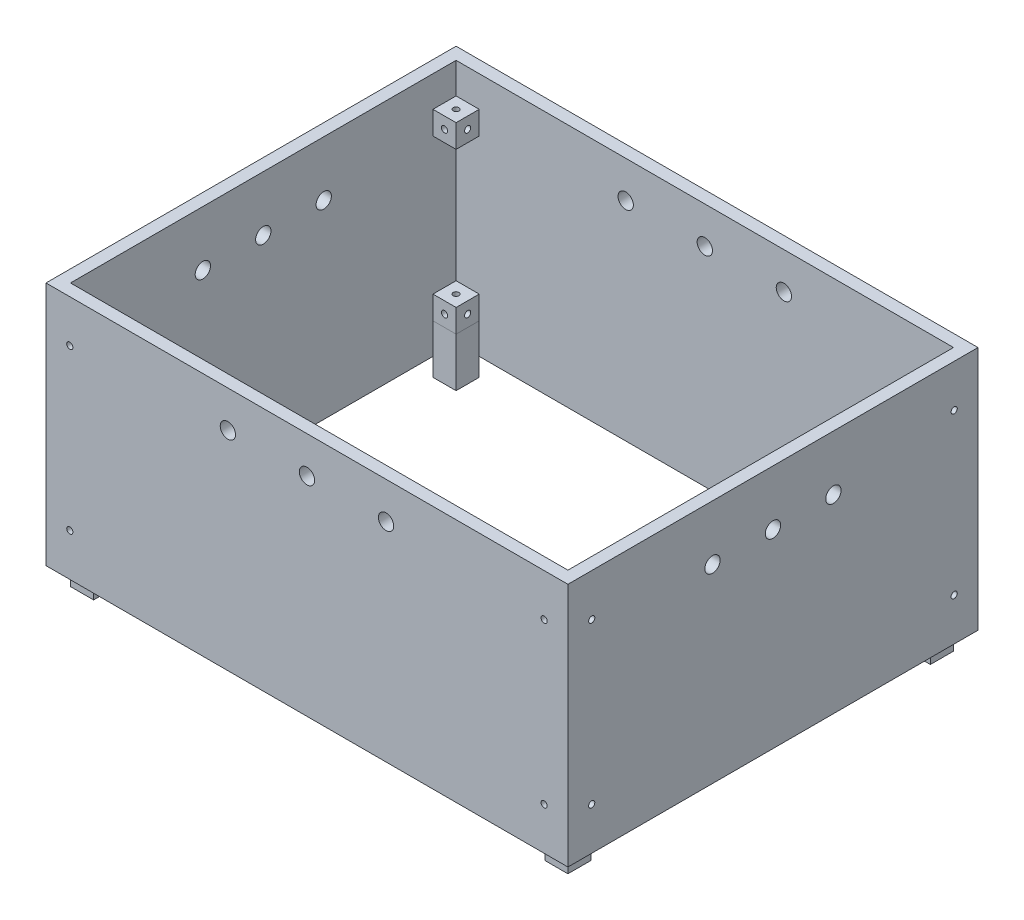
from build123d import *

# Parameters (mm, degrees)
SKETCH1_W            = 270.7
SKETCH1_H            = 212.7
SKETCH1_W_2          = 258
SKETCH1_H_2          = 200
WALLS_DEPTH          = 127
SKETCH2_R            = 3.96875
RODHOLESHEIGHT_DEPTH = 367.945200268
SKETCH4_R            = 3.96875
RODHOLESWIDTH_DEPTH  = 367.945200268
SKETCH3_W            = 12
SKETCH3_H            = 12
MODDINGCUBE_DEPTH    = 12
SKETCH11_R           = 1.6
CUT_EXTRUDE1_DEPTH   = 357.622226593
SKETCH17_R           = 1.5
SKETCH17_R_2         = 1.6
CUT_EXTRUDE4_DEPTH   = 359.218899557
SKETCH15_R           = 1.6
CUT_EXTRUDE2_DEPTH   = 354.625243019
SKETCH18_W           = 12
SKETCH18_H           = 12
PEGS_DEPTH           = 25.4
PEGS_2_DEPTH         = 25.4
PEGS_3_DEPTH         = 25.4
PEGS_4_DEPTH         = 25.4


with BuildPart() as part:
    # Sketch1 → Walls (new body)
    with BuildSketch(Plane(origin=(0, 0, 0), x_dir=(1, 0, 0), z_dir=(0, 1, 0))):
        with Locations((135.35, 106.35)):
            Rectangle(SKETCH1_W, SKETCH1_H)
        with Locations((135.35, 106.35)):
            Rectangle(SKETCH1_W_2, SKETCH1_H_2, mode=Mode.SUBTRACT)
    extrude(amount=WALLS_DEPTH)

    # Sketch2 → RodHolesHeight (cut, through all)
    with BuildSketch(Plane.XY):
        with Locations((135.35, 107.95)):
            Circle(SKETCH2_R)
        with Locations((94.33, 107.95)):
            Circle(SKETCH2_R)
        with Locations((176.366666667, 107.95)):
            Circle(SKETCH2_R)
    extrude(amount=-RODHOLESHEIGHT_DEPTH, mode=Mode.SUBTRACT)

    # Sketch4 → RodHolesWidth (cut, through all)
    with BuildSketch(Plane.ZY):
        with Locations((-106.35, 98.425)):
            Circle(SKETCH4_R)
        with Locations((-137.7, 98.425)):
            Circle(SKETCH4_R)
        with Locations((-75, 98.425)):
            Circle(SKETCH4_R)
    extrude(amount=-RODHOLESWIDTH_DEPTH, mode=Mode.SUBTRACT)

    # Sketch3 → ModdingCube (add)
    with BuildSketch(Plane(origin=(0, 0, -6.35), x_dir=(-1, 0, 0), z_dir=(0, 0, -1))):
        with Locations((-258.35, 105)):
            Rectangle(SKETCH3_W, SKETCH3_H)
        with Locations((-258.35, 22)):
            Rectangle(SKETCH3_W, SKETCH3_H)
        with Locations((-12.35, 105)):
            Rectangle(SKETCH3_W, SKETCH3_H)
        with Locations((-12.35, 22)):
            Rectangle(SKETCH3_W, SKETCH3_H)
    moddingcube = extrude(amount=MODDINGCUBE_DEPTH)

    # Sketch11 → Cut-Extrude1 (cut, symmetric)
    with BuildSketch(Plane(origin=(0, 0, -18.35), x_dir=(-1, 0, 0), z_dir=(0, 0, -1))):
        with Locations((-258.35, 105)):
            Circle(SKETCH11_R)
        with Locations((-258.35, 22)):
            Circle(SKETCH11_R)
        with Locations((-12.35, 105)):
            Circle(SKETCH11_R)
        with Locations((-12.35, 22)):
            Circle(SKETCH11_R)
    cut_extrude1 = extrude(amount=CUT_EXTRUDE1_DEPTH, both=True, mode=Mode.SUBTRACT)

    # Sketch17 → Cut-Extrude4 (cut, symmetric)
    with BuildSketch(Plane(origin=(0, 28, 0), x_dir=(1, 0, 0), z_dir=(0, 1, 0))):
        with Locations((12.35, 12.35)):
            Circle(SKETCH17_R)
        with Locations((258.35, 12.35)):
            Circle(SKETCH17_R_2)
    cut_extrude4 = extrude(amount=CUT_EXTRUDE4_DEPTH, both=True, mode=Mode.SUBTRACT)

    # Sketch15 → Cut-Extrude2 (cut, symmetric)
    with BuildSketch(Plane.ZY.offset(-252.35)):
        with Locations((-12.35, 105)):
            Circle(SKETCH15_R)
        with Locations((-12.35, 22)):
            Circle(SKETCH15_R)
    cut_extrude2 = extrude(amount=CUT_EXTRUDE2_DEPTH, both=True, mode=Mode.SUBTRACT)

    # Mirror6: ModdingCube, Cut-Extrude1, Cut-Extrude4, Cut-Extrude2 across plane
    add(moddingcube.mirror(Plane(origin=(0, 0, -106.35), x_dir=(1, 0, 0), z_dir=(0, 0, -1))))
    add(cut_extrude1.mirror(Plane(origin=(0, 0, -106.35), x_dir=(1, 0, 0), z_dir=(0, 0, -1))), mode=Mode.SUBTRACT)
    add(cut_extrude4.mirror(Plane(origin=(0, 0, -106.35), x_dir=(1, 0, 0), z_dir=(0, 0, -1))), mode=Mode.SUBTRACT)
    add(cut_extrude2.mirror(Plane(origin=(0, 0, -106.35), x_dir=(1, 0, 0), z_dir=(0, 0, -1))), mode=Mode.SUBTRACT)


with BuildPart() as body_2:
    # Sketch18 → Pegs (new body)
    with BuildSketch(Plane.XZ.offset(-16)):
        with Locations((12.35, -12.35)):
            Rectangle(SKETCH18_W, SKETCH18_H)
    extrude(amount=PEGS_DEPTH)


with BuildPart() as body_3:
    # Sketch18 → Pegs 2 (new body)
    with BuildSketch(Plane.XZ.offset(-16)):
        with Locations((12.35, -200.35)):
            Rectangle(SKETCH18_W, SKETCH18_H)
    extrude(amount=PEGS_2_DEPTH)


with BuildPart() as body_4:
    # Sketch18 → Pegs 3 (new body)
    with BuildSketch(Plane.XZ.offset(-16)):
        with Locations((258.35, -200.35)):
            Rectangle(SKETCH18_W, SKETCH18_H)
    extrude(amount=PEGS_3_DEPTH)


with BuildPart() as body_5:
    # Sketch18 → Pegs 4 (new body)
    with BuildSketch(Plane.XZ.offset(-16)):
        with Locations((258.35, -12.35)):
            Rectangle(SKETCH18_W, SKETCH18_H)
    extrude(amount=PEGS_4_DEPTH)


solid = Compound([part.part, body_2.part, body_3.part, body_4.part, body_5.part])
